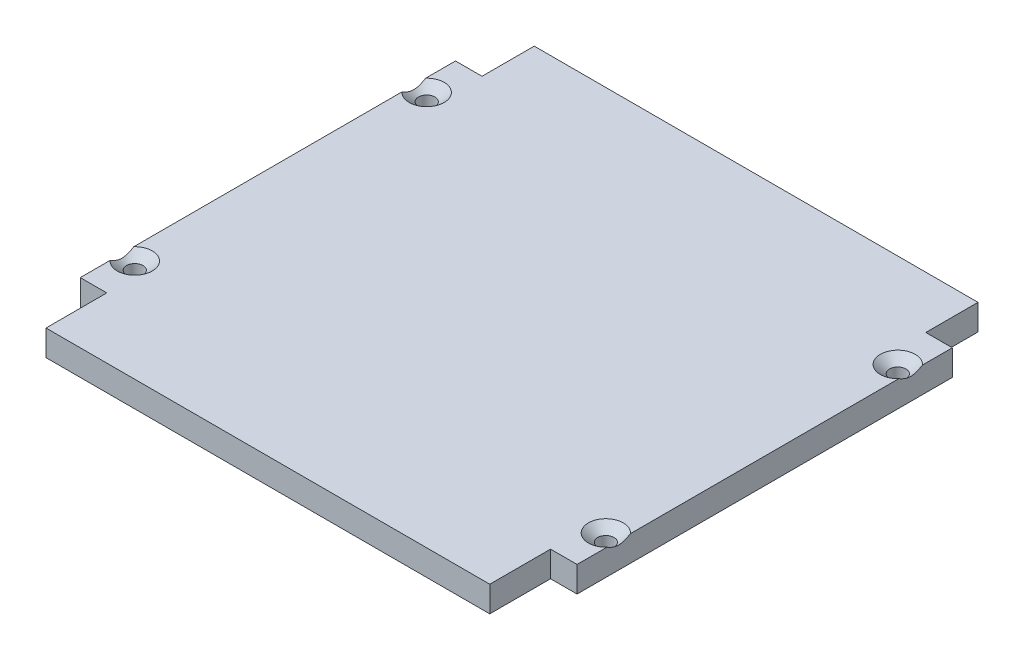
from build123d import *

# Parameters (mm, degrees)
SKETCH1_R           = 1.524
BOSS_EXTRUDE1_DEPTH = 4.7625
CHAMFER1_SIZE       = 1.490392112
CHAMFER1_SIZE_2     = 1.7145


with BuildPart() as part:
    # Sketch1 → Boss-Extrude1 (new body)
    with BuildSketch(Plane(origin=(0, 0, 0), x_dir=(1, 0, 0), z_dir=(0, 1, 0))):
        Polygon((-41.1226, 44.45), (41.1226, 44.45), (41.1226, 34.7726), (46.0375, 34.7726), (46.0375, -34.7726), (41.1226, -34.7726), (41.1226, -46.0375), (-41.1226, -46.0375), (-41.1226, -34.7726), (-46.0375, -34.7726), (-46.0375, 34.7726), (-41.1226, 34.7726), align=None)
        with Locations(Location((43.65625, 27.051, 0), (0, 0, 90))):
            Circle(SKETCH1_R, mode=Mode.SUBTRACT)
        with Locations(Location((43.65625, -27.051, 0), (0, 0, 90))):
            Circle(SKETCH1_R, mode=Mode.SUBTRACT)
        with Locations(Location((-43.65625, -27.051, 0), (0, 0, 90))):
            Circle(SKETCH1_R, mode=Mode.SUBTRACT)
        with Locations(Location((-43.65625, 27.051, 0), (0, 0, 90))):
            Circle(SKETCH1_R, mode=Mode.SUBTRACT)
    extrude(amount=BOSS_EXTRUDE1_DEPTH)

    # Chamfer1
    # the kernel refuses this chamfer: 1.7145, 1.490392112 mm, written as the material it takes off along each edge
    with BuildSketch(Plane(origin=(43.65625, 4.7625, -27.051), x_dir=(0, 0, -1), z_dir=(1, 0, 0))) as chamfer1_piece_1:
        Polygon((1.524, -CHAMFER1_SIZE), (1.524 + CHAMFER1_SIZE_2, 0), (1.524, 0), align=None)
    revolve(axis=Axis((43.65625, 4.7625, -27.051), (0, 1, 0)), mode=Mode.SUBTRACT)
    with BuildSketch(Plane(origin=(43.65625, 4.7625, 27.051), x_dir=(0, 0, -1), z_dir=(1, 0, 0))) as chamfer1_piece_2:
        Polygon((1.524, -CHAMFER1_SIZE), (1.524 + CHAMFER1_SIZE_2, 0), (1.524, 0), align=None)
    revolve(axis=Axis((43.65625, 4.7625, 27.051), (0, 1, 0)), mode=Mode.SUBTRACT)
    with BuildSketch(Plane(origin=(-43.65625, 4.7625, 27.051), x_dir=(0, 0, -1), z_dir=(1, 0, 0))) as chamfer1_piece_3:
        Polygon((1.524, -CHAMFER1_SIZE), (1.524 + CHAMFER1_SIZE_2, 0), (1.524, 0), align=None)
    revolve(axis=Axis((-43.65625, 4.7625, 27.051), (0, 1, 0)), mode=Mode.SUBTRACT)
    with BuildSketch(Plane(origin=(-43.65625, 4.7625, -27.051), x_dir=(0, 0, -1), z_dir=(1, 0, 0))) as chamfer1_piece_4:
        Polygon((1.524, -CHAMFER1_SIZE), (1.524 + CHAMFER1_SIZE_2, 0), (1.524, 0), align=None)
    revolve(axis=Axis((-43.65625, 4.7625, -27.051), (0, 1, 0)), mode=Mode.SUBTRACT)


solid = part.part
